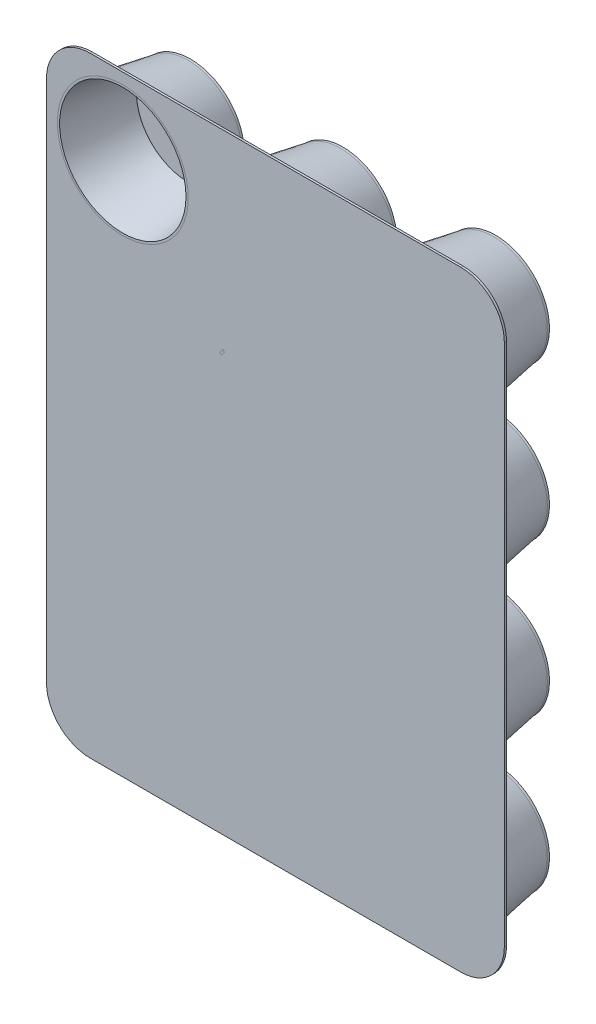
from build123d import *

# Parameters (mm, degrees)
SKETCH1_W          = 266.7
SKETCH1_H          = 355.6
EXTRUDE1_DEPTH     = 1.27
SKETCH4_R          = 38.1
CUT_EXTRUDE8_DEPTH = 1.27
SKETCH5_R          = 31.3944
EXTRUDE2_DEPTH     = 1.27
LPATTERN5_COUNT    = 4
LPATTERN5_PITCH    = 88.9
LPATTERN5_2_COUNT  = 3
LPATTERN5_2_PITCH  = 88.9
FILLET1_R          = 25.4
FILLET2_R          = 25.4
FILLET3_R          = 25.4
FILLET4_R          = 25.4


# Read off the part's stored shape, not the designer's step: Loft1, Shell2
with BuildPart() as part:
    # Sketch1 → Extrude1 (new body)
    with BuildSketch(Plane.XY):
        with Locations((-0.529166667, 11.143707218)):
            Rectangle(SKETCH1_W, SKETCH1_H)
    extrude(amount=-EXTRUDE1_DEPTH)

    # Sketch4 → Cut-Extrude8 (cut)
    with BuildSketch(Plane.XY):
        with Locations((-89.429166667, 144.493707218)):
            Circle(SKETCH4_R)
    extrude(amount=-CUT_EXTRUDE8_DEPTH, mode=Mode.SUBTRACT)

    # Fillet1
    fillet1_edges = [part.edges().sort_by_distance(p)[0] for p in [
        (-133.879166667, 188.943707218, -0.635),
    ]]
    fillet(fillet1_edges, radius=FILLET1_R)

    # Fillet2
    fillet2_edges = [part.edges().sort_by_distance(p)[0] for p in [
        (132.820833333, 188.943707218, -0.635),
    ]]
    fillet(fillet2_edges, radius=FILLET2_R)

    # Fillet3
    fillet3_edges = [part.edges().sort_by_distance(p)[0] for p in [
        (132.820833333, -166.656292782, -0.635),
    ]]
    fillet(fillet3_edges, radius=FILLET3_R)

    # Fillet4
    fillet4_edges = [part.edges().sort_by_distance(p)[0] for p in [
        (-133.879166667, -166.656292782, -0.635),
    ]]
    fillet(fillet4_edges, radius=FILLET4_R)


with BuildPart() as body_2:
    # Sketch5 → Extrude2 (new body)
    with BuildSketch(Plane.XY.offset(-38.1)):
        with Locations((-89.429166667, 144.493707218)):
            Circle(SKETCH5_R)
    extrude(amount=-EXTRUDE2_DEPTH)

    # Loft1 outline → Loft1 (revolve)
    with BuildSketch(Plane(origin=(-89.429166667, 144.493707218, 0), x_dir=(1, 0, 0), z_dir=(0, -1, 0))):
        Polygon((38.1, 0), (0, 0), (0, -38.1), (31.3944, -38.1), align=None)
    revolve(axis=Axis((-89.429166667, 144.493707218, 0), (0, 0, 1)))

    # Shell2 outline → Shell2 (revolve, cut)
    with BuildSketch(Plane(origin=(-89.429166667, 144.493707218, 0), x_dir=(1, 0, 0), z_dir=(0, -1, 0))):
        Polygon((0, -38.1), (30.1244, -38.1), (30.1244, -37.989092319), (36.810480248, 0), (0, 0), align=None)
    revolve(axis=Axis((-89.429166667, 144.493707218, 0), (0, 0, 1)), mode=Mode.SUBTRACT)


with BuildPart() as lpattern5_1:
    # LPattern5: pattern copy
    add(body_2.part.moved(Location(Vector(0, -1, 0) * (1 * LPATTERN5_PITCH))))


with BuildPart() as lpattern5_2:
    # LPattern5: pattern copy
    add(body_2.part.moved(Location(Vector(0, -1, 0) * (2 * LPATTERN5_PITCH))))


with BuildPart() as lpattern5_3:
    # LPattern5: pattern copy
    add(body_2.part.moved(Location(Vector(0, -1, 0) * (3 * LPATTERN5_PITCH))))


with BuildPart() as lpattern5_2_1:
    # LPattern5 2: pattern copy
    add(body_2.part.moved(Location(Vector(1, 0, 0) * (1 * LPATTERN5_2_PITCH))))


with BuildPart() as lpattern5_2_2:
    # LPattern5 2: pattern copy
    add(body_2.part.moved(Location(Vector(1, 0, 0) * (2 * LPATTERN5_2_PITCH))))


with BuildPart() as lpattern5_2_3:
    # LPattern5 2: pattern copy
    add(lpattern5_1.part.moved(Location(Vector(1, 0, 0) * (1 * LPATTERN5_2_PITCH))))


with BuildPart() as lpattern5_2_4:
    # LPattern5 2: pattern copy
    add(lpattern5_1.part.moved(Location(Vector(1, 0, 0) * (2 * LPATTERN5_2_PITCH))))


with BuildPart() as lpattern5_2_5:
    # LPattern5 2: pattern copy
    add(lpattern5_2.part.moved(Location(Vector(1, 0, 0) * (1 * LPATTERN5_2_PITCH))))


with BuildPart() as lpattern5_2_6:
    # LPattern5 2: pattern copy
    add(lpattern5_2.part.moved(Location(Vector(1, 0, 0) * (2 * LPATTERN5_2_PITCH))))


with BuildPart() as lpattern5_2_7:
    # LPattern5 2: pattern copy
    add(lpattern5_3.part.moved(Location(Vector(1, 0, 0) * (1 * LPATTERN5_2_PITCH))))


with BuildPart() as lpattern5_2_8:
    # LPattern5 2: pattern copy
    add(lpattern5_3.part.moved(Location(Vector(1, 0, 0) * (2 * LPATTERN5_2_PITCH))))


solid = Compound([part.part, body_2.part, lpattern5_1.part, lpattern5_2.part, lpattern5_3.part, lpattern5_2_1.part, lpattern5_2_2.part, lpattern5_2_3.part, lpattern5_2_4.part, lpattern5_2_5.part, lpattern5_2_6.part, lpattern5_2_7.part, lpattern5_2_8.part])
